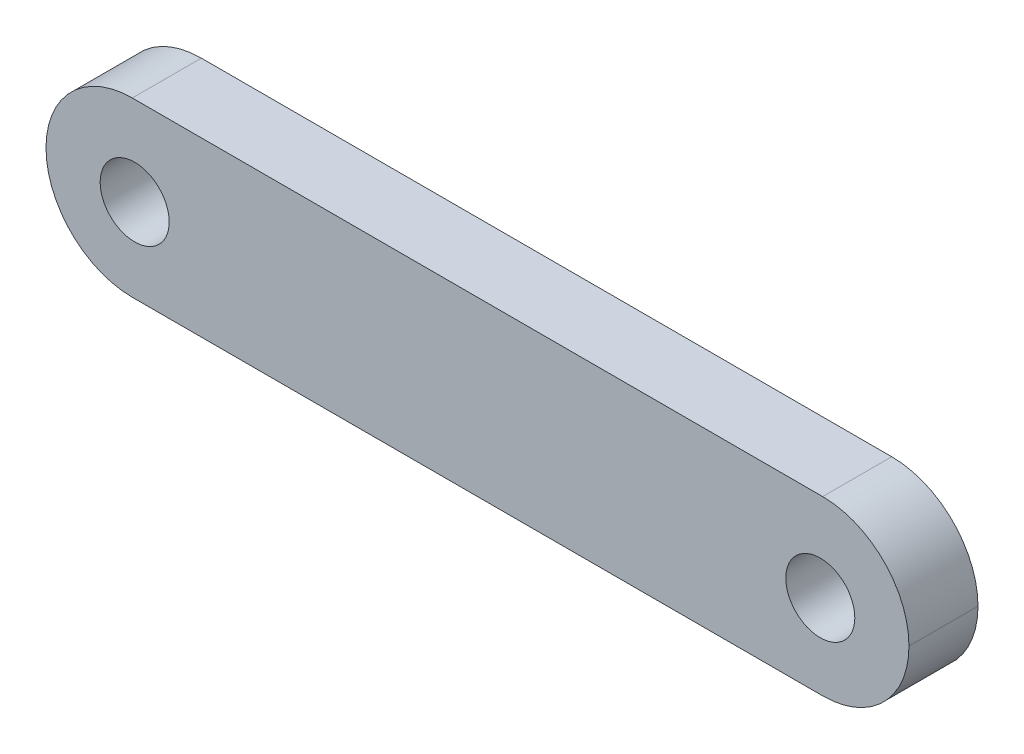
from build123d import *

# Parameters (mm, degrees)
SKETCH1_W           = 25
SKETCH1_H           = 5
SKETCH1_R           = 1
BOSS_EXTRUDE1_DEPTH = 2
FILLET1_R           = 2.5


with BuildPart() as part:
    # Sketch1 → Boss-Extrude1 (new body)
    with BuildSketch(Plane.XY):
        Rectangle(SKETCH1_W, SKETCH1_H)
        with Locations((9.931042695, -0.076752974)):
            Circle(SKETCH1_R, mode=Mode.SUBTRACT)
        with Locations(Location((-9.931042695, -0.076752974, 0), (0, 0, 180))):
            Circle(SKETCH1_R, mode=Mode.SUBTRACT)
    extrude(amount=BOSS_EXTRUDE1_DEPTH)

    # Fillet1
    fillet1_edges = [part.edges().sort_by_distance(p)[0] for p in [
        (-12.5, -2.5, 1),
        (-12.5, 2.5, 1),
        (12.5, -2.5, 1),
        (12.5, 2.5, 1),
    ]]
    fillet(fillet1_edges, radius=FILLET1_R - 0.0001)  # a hair under: the kernel refuses the full size


solid = part.part
